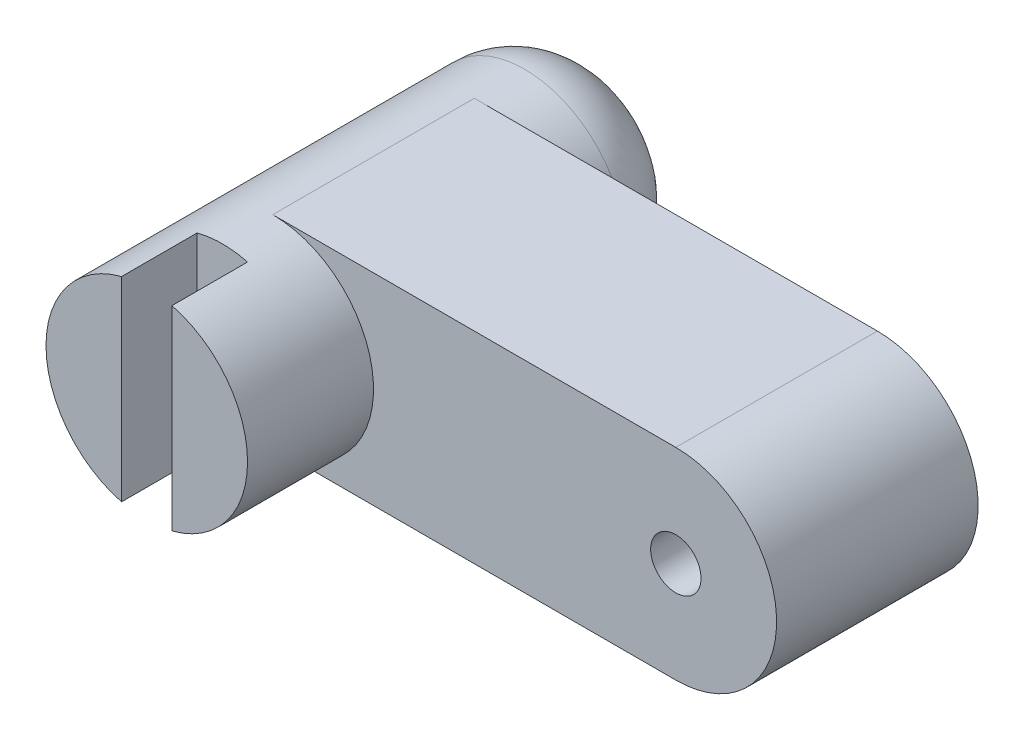
from build123d import *

# Parameters (mm, degrees)
SKETCH_1_R          = 2
SKETCH_1_R_2        = 0.5
EXTRUDE_1_DEPTH     = 9
SKETCH_2_W          = 1
SKETCH_2_H          = 4.164709902
CUT_EXTRUDE_1_DEPTH = 1.5
FILLET_2_R          = 1.5
SKETCH_3_W          = 8
SKETCH_3_H          = 4
EXTRUDE_2_DEPTH     = 2
SKETCH_4_R          = 2
SKETCH_4_R_2        = 0.5
EXTRUDE_3_DEPTH     = 4
SKETCH_5_R          = 0.5
CUT_EXTRUDE_2_DEPTH = 4
SKETCH_6_R          = 0.5
CUT_EXTRUDE_3_DEPTH = 14.601470509


with BuildPart() as part:
    # 草图1 → 凸台-拉伸1 (new body)
    with BuildSketch(Plane.XY):
        Circle(SKETCH_1_R)
        Circle(SKETCH_1_R_2, mode=Mode.SUBTRACT)
    extrude(amount=EXTRUDE_1_DEPTH)

    # 草图2 → 切除-拉伸1 (cut)
    with BuildSketch(Plane.XY.offset(9)):
        Rectangle(SKETCH_2_W, SKETCH_2_H)
    extrude(amount=-CUT_EXTRUDE_1_DEPTH, mode=Mode.SUBTRACT)

    # 圆角2
    fillet_2_edges = [part.edges().sort_by_distance(p)[0] for p in [
        (-2, 0, 0),
    ]]
    fillet(fillet_2_edges, radius=FILLET_2_R - 0.0001)  # a hair under: the kernel refuses the full size

    # 草图3 → 凸台-拉伸2 (add, symmetric)
    with BuildSketch(Plane(origin=(0, 0, 0), x_dir=(1, 0, 0), z_dir=(0, 1, 0))):
        with Locations((4, -4.5)):
            Rectangle(SKETCH_3_W, SKETCH_3_H)
    extrude(amount=EXTRUDE_2_DEPTH, both=True)

    # 草图4 → 凸台-拉伸3 (add)
    with BuildSketch(Plane(origin=(0, 0, 2.5), x_dir=(-1, 0, 0), z_dir=(0, 0, -1))):
        with Locations((-8, 0)):
            Circle(SKETCH_4_R)
        with Locations((-8, 0)):
            Circle(SKETCH_4_R_2, mode=Mode.SUBTRACT)
    extrude(amount=-EXTRUDE_3_DEPTH)

    # 草图5 → 切除-拉伸2 (cut)
    with BuildSketch(Plane(origin=(0, 0, 2.5), x_dir=(-1, 0, 0), z_dir=(0, 0, -1))):
        with Locations((-8, 0)):
            Circle(SKETCH_5_R)
    extrude(amount=-CUT_EXTRUDE_2_DEPTH, mode=Mode.SUBTRACT)

    # 草图6 → 切除-拉伸3 (cut, through all)
    with BuildSketch(Plane.XY.offset(9)):
        Circle(SKETCH_6_R)
    extrude(amount=-CUT_EXTRUDE_3_DEPTH, mode=Mode.SUBTRACT)


solid = part.part
